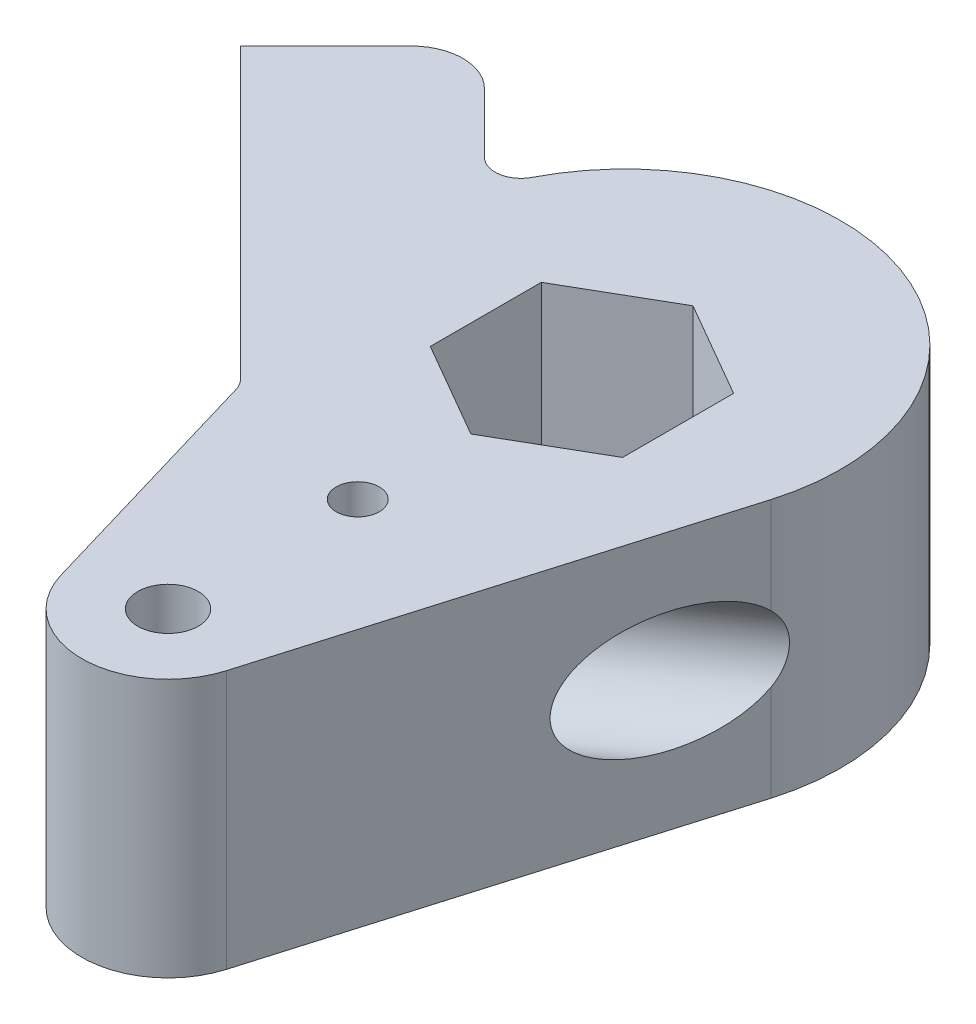
from build123d import *

# Parameters (mm, degrees)
SKETCH1_R           = 1.75
BOSS_EXTRUDE1_DEPTH = 15
SKETCH10_R          = 1.25
CUT_EXTRUDE3_DEPTH  = 35.960692213
SKETCH11_R          = 1.95
CUT_EXTRUDE4_DEPTH  = 47.58229165
SKETCH12_R          = 3.5
BOSS_EXTRUDE8_DEPTH = 5
BOSS_EXTRUDE9_DEPTH = 15
SKETCH14_R          = 2.75
CUT_EXTRUDE5_DEPTH  = 37.697714159
FILLET1_R           = 3
FILLET2_R           = 1.5
SKETCH15_R          = 3.5
CUT_EXTRUDE6_DEPTH  = 13


with BuildPart() as part:
    # Sketch1 → Boss-Extrude1 (new body)
    with BuildSketch(Plane(origin=(0, 0, 0), x_dir=(1, 0, 0), z_dir=(0, 1, 0))):
        with BuildLine():
            Line((-4.795571708, -25.41509434), (-11.988929271, -1.037735849))
            ThreePointArc((-11.988929271, -1.037735849), (0, 15), (11.988929271, -1.037735849))
            Line((11.988929271, -1.037735849), (4.795571708, -25.41509434))
            ThreePointArc((4.795571708, -25.41509434), (0, -29), (-4.795571708, -25.41509434))
        make_face()
        with Locations(Location((0, -24, 0), (0, 0, 270))):
            Circle(SKETCH1_R, mode=Mode.SUBTRACT)
        Polygon((0, -6.437455501), (5.575, -3.218727751), (5.575, 3.218727751), (0, 6.437455501), (-5.575, 3.218727751), (-5.575, -3.218727751), align=None, mode=Mode.SUBTRACT)
    extrude(amount=BOSS_EXTRUDE1_DEPTH)

    # Sketch10 → Cut-Extrude3 (cut, through all)
    with BuildSketch(Plane(origin=(0, 0, 0), x_dir=(1, 0, 0), z_dir=(0, 1, 0))):
        with Locations(Location((0, -13, 0), (0, 0, 270))):
            Circle(SKETCH10_R)
    extrude(amount=CUT_EXTRUDE3_DEPTH, mode=Mode.SUBTRACT)

    # Sketch11 → Cut-Extrude4 (cut, through all)
    with BuildSketch(Plane(origin=(7.806004581, 0, 24.148129883), x_dir=(0.5735764363510473, 0, 0.819152044288991), z_dir=(-0.819152044288991, 0, 0.5735764363510473))):
        with Locations((-13.609353673, 7.5)):
            Circle(SKETCH11_R)
    extrude(amount=-CUT_EXTRUDE4_DEPTH, mode=Mode.SUBTRACT)

    # Sketch12 → Boss-Extrude8 (add)
    with BuildSketch(Plane(origin=(0, 0, 0), x_dir=(1, 0, 0), z_dir=(0, 1, 0))):
        Polygon((5.575, -3.218727751), (5.575, 3.218727751), (0, 6.437455501), (-5.575, 3.218727751), (-5.575, -3.218727751), (0, -6.437455501), align=None)
        with Locations(Location((0, 0, 0), (0, 0, 270))):
            Circle(SKETCH12_R, mode=Mode.SUBTRACT)
    extrude(amount=BOSS_EXTRUDE8_DEPTH)

    # Sketch13 → Boss-Extrude9 (add)
    with BuildSketch(Plane(origin=(0, 0, 0), x_dir=(1, 0, 0), z_dir=(0, 1, 0))):
        Polygon((-19.091883092, 13.435028843), (-26.162950904, 6.363961031), (-8, -11.798989873), (-8, 2.343145751), align=None)
    extrude(amount=BOSS_EXTRUDE9_DEPTH)

    # Sketch14 → Cut-Extrude5 (cut, through all)
    with BuildSketch(Plane(origin=(-9.899494937, 0, 9.899494937), x_dir=(0.707106781186549, 0, 0.707106781186546), z_dir=(-0.707106781186546, 0, 0.707106781186549))):
        with Locations((-18, 7.5)):
            Circle(SKETCH14_R)
    extrude(amount=-CUT_EXTRUDE5_DEPTH, mode=Mode.SUBTRACT)

    # Fillet1
    # the kernel refuses this fillet: 3 mm, written as the material it takes off along each edge
    with BuildSketch(Plane(origin=(-19.091883092, -7.5, -13.435028843), x_dir=(0.7071067811865492, 0, 0.7071067811865457), z_dir=(0, 1, 0))) as fillet1_piece_1:
        with BuildLine():
            CenterArc((FILLET1_R, -FILLET1_R), FILLET1_R, 90, 90)
            Line((0, -FILLET1_R), (0, 0))
            Line((0, 0), (FILLET1_R, 0))
        make_face()
    extrude(amount=30, mode=Mode.SUBTRACT)

    # Fillet2
    fillet2_edges = [part.edges().sort_by_distance(p)[0] for p in [
        (-9.153981014, 7.5, 10.645008859),
        (-11.920074413, 7.5, -6.263220163),
    ]]
    fillet(fillet2_edges, radius=FILLET2_R)

    # Sketch15 → Cut-Extrude6 (cut)
    with BuildSketch(Plane(origin=(10.275038851, 0, -7.194659659), x_dir=(0, -1, 0), z_dir=(0.819152044288991, 0, -0.5735764363510473))):
        with Locations(Location((-7.5, -10.648976576, 0), (0, 0, 90))):
            Circle(SKETCH15_R)
    extrude(amount=-CUT_EXTRUDE6_DEPTH, mode=Mode.SUBTRACT)


solid = part.part
